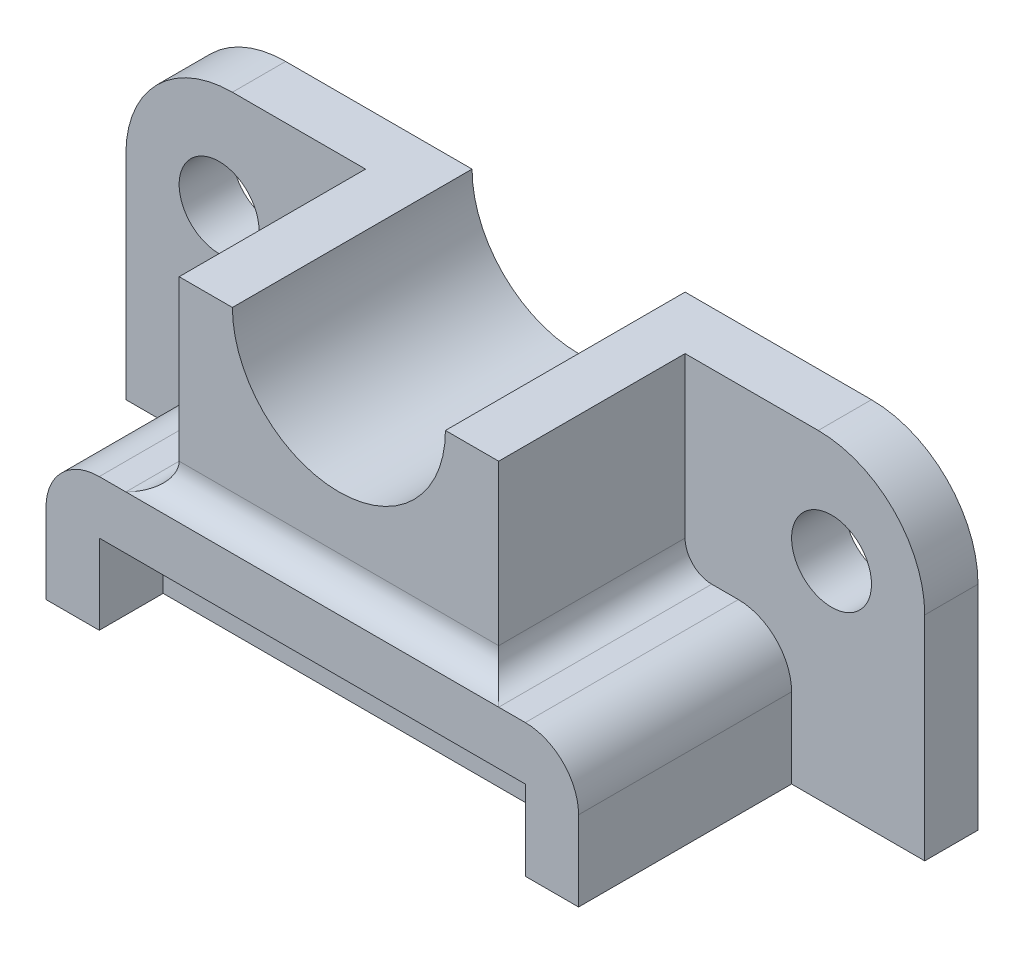
from build123d import *

# Parameters (mm, degrees)
ESBO_O1_W                  = 150
ESBO_O1_H                  = 60
RESSALTO_EXTRUS_O1_DEPTH   = 10
RESSALTO_EXTRUS_O2_DEPTH   = 40
FILETE1_R                  = 20
FILETE2_R                  = 10
CORTE_EXTRUS_O2_DEPTH      = 10
CORTE_EXTRUS_O2_DEPTH_BACK = 10
ESBO_O4_R                  = 7.5
RESSALTO_EXTRUS_O5_START   = 10
RESSALTO_EXTRUS_O5_DEPTH   = 35
CORTE_EXTRUS_O3_START      = -10
ESBO_O7_R                  = 20
CORTE_EXTRUS_O3_DEPTH      = 10
FILETE4_R                  = 5
ESBO_O8_W                  = 80
ESBO_O8_H                  = 15
RESSALTO_EXTRUS_O6_DEPTH   = 38


with BuildPart() as part:
    # Esboço1 → Ressalto-extrusão1 (new body)
    with BuildSketch(Plane.XY):
        Rectangle(ESBO_O1_W, ESBO_O1_H)
    extrude(amount=RESSALTO_EXTRUS_O1_DEPTH)

    # Esboço3 → Ressalto-extrusão2 (add)
    with BuildSketch(Plane.XY.offset(10)):
        Polygon((-50, -30), (-40, -30), (-40, -15), (40, -15), (40, -30), (50, -30), (50, -5), (-50, -5), align=None)
    extrude(amount=RESSALTO_EXTRUS_O2_DEPTH)

    # Filete1
    filete1_edges = [part.edges().sort_by_distance(p)[0] for p in [
        (-75, 30, 5),
        (75, 30, 5),
    ]]
    fillet(filete1_edges, radius=FILETE1_R)

    # Filete2
    filete2_edges = [part.edges().sort_by_distance(p)[0] for p in [
        (50, -5, 30),
        (-50, -5, 30),
    ]]
    fillet(filete2_edges, radius=FILETE2_R)

    # Esboço4 → Corte-extrusão2 (cut, two sides: drawn at the far end of the back side and taken through both)
    with BuildSketch(Plane.XY.offset(-CORTE_EXTRUS_O2_DEPTH_BACK)):
        with Locations((-57.5, 10)):
            Circle(ESBO_O4_R)
        with Locations((57.5, 10)):
            Circle(ESBO_O4_R)
    extrude(amount=CORTE_EXTRUS_O2_DEPTH + CORTE_EXTRUS_O2_DEPTH_BACK, mode=Mode.SUBTRACT)

    # Esboço5 → Ressalto-extrusão5 (add)
    with BuildSketch(Plane.XY.offset(RESSALTO_EXTRUS_O5_START)):
        with BuildLine():
            Line((-30, 30), (-30, -5))
            Line((-30, -5), (30, -5))
            Line((30, -5), (30, 30))
            Line((30, 30), (20, 30))
            ThreePointArc((20, 30), (0, 10), (-20, 30))
            Line((-20, 30), (-30, 30))
        make_face()
    extrude(amount=RESSALTO_EXTRUS_O5_DEPTH)

    # Esboço7 → Corte-extrusão3 (cut)
    with BuildSketch(Plane.XY.offset(10).offset(CORTE_EXTRUS_O3_START)):
        with Locations((0, 30)):
            Circle(ESBO_O7_R)
    extrude(amount=CORTE_EXTRUS_O3_DEPTH, mode=Mode.SUBTRACT)

    # Filete4
    filete4_edges = [part.edges().sort_by_distance(p)[0] for p in [
        (0, -5, 45),
        (-30, -5, 27.5),
        (30, -5, 27.5),
    ]]
    fillet(filete4_edges, radius=FILETE4_R - 0.0001)  # a hair under: the kernel refuses the full size

    # Esboço8 → Ressalto-extrusão6 (add)
    with BuildSketch(Plane.XY):
        with Locations((0, -22.5)):
            Rectangle(ESBO_O8_W, ESBO_O8_H)
    extrude(amount=RESSALTO_EXTRUS_O6_DEPTH)


solid = part.part
